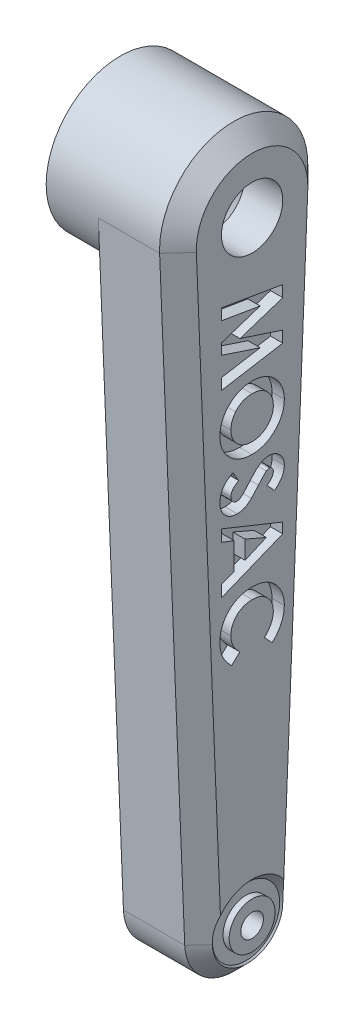
from build123d import *

# Parameters (mm, degrees)
BOSS_EXTRUDE1_DEPTH = 16
BOSS_EXTRUDE2_START = 5.5
SKETCH2_R           = 12.1
BOSS_EXTRUDE2_DEPTH = 5.5
SKETCH3_R           = 1.85
TORNILLO_INF_DEPTH  = 110.847212072
SKETCH4_R           = 1.75
TORNILLO_SUP_DEPTH  = 111.782038255
SKETCH6_R           = 10.8
SKETCH6_R_2         = 1.75
CUT_EXTRUDE4_DEPTH  = 4
SKETCH5_R           = 5
SKETCH5_R_2         = 1.65
CUT_EXTRUDE3_DEPTH  = 8.25
CHAMFER1_SIZE       = 2
CHAMFER2_SIZE       = 3
CHAMFER3_SIZE       = 3
MOSAC_DEPTH         = 2
SKETCH10_R          = 0.8
CUT_EXTRUDE5_DEPTH  = 10
SKETCH11_R          = 5.5
SKETCH11_R_2        = 3.75
CUT_EXTRUDE6_DEPTH  = 1


with BuildPart() as part:
    # Sketch1 → Boss-Extrude1 (new body)
    with BuildSketch(Plane(origin=(0, 0, 0), x_dir=(0, -1, 0), z_dir=(-1, 0, 0))):
        with BuildLine():
            Line((0.4961, -12.089825672), (100.328, -7.993273172))
            ThreePointArc((100.328, -7.993273172), (108, 0), (100.328, 7.993273172))
            Line((100.328, 7.993273172), (0.4961, 12.089825672))
            ThreePointArc((0.4961, 12.089825672), (-12.1, 0), (0.4961, -12.089825672))
        make_face()
    extrude(amount=-BOSS_EXTRUDE1_DEPTH)

    # Sketch2 → Boss-Extrude2 (add)
    with BuildSketch(Plane.ZY.offset(BOSS_EXTRUDE2_START)):
        Circle(SKETCH2_R)
    extrude(amount=-BOSS_EXTRUDE2_DEPTH)

    # Sketch3 → Tornillo_inf (cut, through all)
    with BuildSketch(Plane.ZY):
        with Locations(Location((0, -100, 0), (0, 0, 180))):
            Circle(SKETCH3_R)
    extrude(amount=-TORNILLO_INF_DEPTH, mode=Mode.SUBTRACT)

    # Sketch4 → Tornillo_sup (cut, through all)
    with BuildSketch(Plane.ZY.offset(5.5)):
        with Locations(Location((0, 0, 0), (0, 0, 180))):
            Circle(SKETCH4_R)
    extrude(amount=-TORNILLO_SUP_DEPTH, mode=Mode.SUBTRACT)

    # Sketch6 → Cut-Extrude4 (cut)
    with BuildSketch(Plane.ZY.offset(5.5)):
        with Locations(Location((0, 0, 0), (0, 0, 180))):
            Circle(SKETCH6_R)
        Circle(SKETCH6_R_2, mode=Mode.SUBTRACT)
    extrude(amount=-CUT_EXTRUDE4_DEPTH, mode=Mode.SUBTRACT)

    # Sketch5 → Cut-Extrude3 (cut)
    with BuildSketch(Plane(origin=(16, 0, 0), x_dir=(0, 0, -1), z_dir=(1, 0, 0))):
        with Locations(Location((0, 0, 0), (0, 0, 180))):
            Circle(SKETCH5_R)
        Circle(SKETCH5_R_2, mode=Mode.SUBTRACT)
    extrude(amount=-CUT_EXTRUDE3_DEPTH, mode=Mode.SUBTRACT)

    # Chamfer1
    chamfer1_edges = [part.edges().sort_by_distance(p)[0] for p in [
        (7.75, 0, -5),
    ]]
    chamfer(chamfer1_edges, length=CHAMFER1_SIZE)

    # Chamfer2
    # the kernel refuses this chamfer: 3 mm, written as the material it takes off along each edge
    with BuildSketch(Plane(origin=(0, -100.328, 7.993273172), x_dir=(1, 0, 0), z_dir=(0, 0.9991591464826812, 0.041000000000000016))) as chamfer2_piece_1_section:
        Polygon((CHAMFER2_SIZE, 0), (0, CHAMFER2_SIZE), (0, 0), align=None)
    chamfer2_piece_1 = extrude(amount=113.031497887, mode=Mode.PRIVATE)
    chamfer2_piece_1 = chamfer2_piece_1 - Plane(origin=(0, 0, 0), x_dir=(0, -0.041000000000000016, 0.9991591464826812), z_dir=(-1, 0, 0)) * Cylinder(12.1, 239, mode=Mode.PRIVATE)
    add(chamfer2_piece_1, mode=Mode.SUBTRACT)
    with BuildSketch(Plane(origin=(0, -100, 0), x_dir=(0, -0.041000000000003894, -0.9991591464826811), z_dir=(0, 0.9991591464826811, -0.041000000000003894))) as chamfer2_piece_2:
        Polygon((8, -CHAMFER2_SIZE), (8 - CHAMFER2_SIZE, 0), (8, 0), align=None)
    revolve(axis=Axis((0, -100, 0), (-1, 0, 0)), revolution_arc=175.300428789, mode=Mode.SUBTRACT)
    with BuildSketch(Plane(origin=(0, 12.608454954, -12.627564585), x_dir=(1, 0, 0), z_dir=(0, -0.9991591464826812, 0.041))) as chamfer2_piece_3_section:
        Polygon((CHAMFER2_SIZE, 0), (0, CHAMFER2_SIZE), (0, 0), align=None)
    chamfer2_piece_3 = extrude(amount=113.031497887, mode=Mode.PRIVATE)
    chamfer2_piece_3 = chamfer2_piece_3 - Plane(origin=(0, 0, 0), x_dir=(0, -0.041000000000000016, 0.9991591464826812), z_dir=(-1, 0, 0)) * Cylinder(12.1, 239, mode=Mode.PRIVATE)
    add(chamfer2_piece_3, mode=Mode.SUBTRACT)

    # Chamfer3
    # the kernel refuses this chamfer: 3 mm, written as the material it takes off along each edge
    with BuildSketch(Plane(origin=(16, -100, 0), x_dir=(0, -0.041000000000003894, -0.9991591464826811), z_dir=(0, 0.9991591464826811, -0.041000000000003894))) as chamfer3_piece_1:
        Polygon((8 - CHAMFER3_SIZE, 0), (8, CHAMFER3_SIZE), (8, 0), align=None)
    revolve(axis=Axis((16, -100, 0), (-1, 0, 0)), revolution_arc=175.300428789, mode=Mode.SUBTRACT)
    with BuildSketch(Plane(origin=(16, -100.328, 7.993273172), x_dir=(0, 0.041000000000000016, -0.9991591464826812), z_dir=(0, 0.9991591464826812, 0.041000000000000016)), Plane(origin=(16, -0.4961, -12.089825672), x_dir=(0, 0.040999999999999995, 0.9991591464826812), z_dir=(0, -0.9991591464826812, 0.041))) as chamfer3_piece_2:
        Polygon((CHAMFER3_SIZE, 0), (0, CHAMFER3_SIZE), (0, 0), align=None)
    extrude(amount=99.915914648, mode=Mode.SUBTRACT)
    with BuildSketch(Plane(origin=(16, 0, 0), x_dir=(0, -0.041000000000000016, 0.9991591464826812), z_dir=(0, -0.9991591464826812, -0.041000000000000016))) as chamfer3_piece_3:
        Polygon((12.1 - CHAMFER3_SIZE, 0), (12.1, CHAMFER3_SIZE), (12.1, 0), align=None)
    revolve(axis=Axis((16, 0, 0), (-1, 0, 0)), revolution_arc=184.699571211, mode=Mode.SUBTRACT)

    # Sketch9 → MOSAC (cut)
    # profile 1 of 5: a face of its own
    with BuildSketch(Plane(origin=(16, 0, 0), x_dir=(0, 0, -1), z_dir=(1, 0, 0))):
        Polygon((5, -11.945112179), (5, -13.808092949), (-1.975160256, -16.08974359), (5, -18.387419872), (5, -20.232371795), (-5, -21.923076923), (-5, -20.106169872), (1.316105769, -19.038461538), (-5, -16.959134615), (-5, -15.208333333), (1.316105769, -13.141025641), (-5, -12.075320513), (-5, -10.256410256), align=None)
    # profile 2 of 5: a face of its own
    with BuildSketch(Plane(origin=(16, 0, 0), x_dir=(0, 0, -1), z_dir=(1, 0, 0))):
        with BuildLine():
            add(Edge.make_bspline(
                [(5.256410256, -28.289262821), (5.251911336, -28.463126485), (5.243029449, -28.806372739), (5.168909094, -29.311139709), (5.048346913, -29.797670768), (4.879822721, -30.26586282), (4.662290096, -30.715079941), (4.394853416, -31.144170534), (4.081675968, -31.555904705), (3.72333301, -31.942681214), (3.331751316, -32.297459349), (2.914253996, -32.609391489), (2.475499253, -32.873461463), (2.015876125, -33.089411423), (1.534427408, -33.256631048), (1.031404493, -33.373354539), (0.507735829, -33.44851956), (0.1511695, -33.457151469), (-0.030048077, -33.461538462)],
                knots=[0, 0, 0, 0, 1.014244935, 2.002349224, 2.970143685, 3.935298574, 4.900830986, 5.877310296, 6.881148894, 7.915268703, 8.949887647, 9.960720774, 10.951801935, 11.933244874, 12.919141415, 13.920101769, 14.942934067, 16, 16, 16, 16], degree=3))
            add(Edge.make_bspline(
                [(-0.030048077, -33.461538462), (-0.209223951, -33.456866533), (-0.56229576, -33.447660349), (-1.081135725, -33.376417808), (-1.578780794, -33.25773966), (-2.055516166, -33.093291481), (-2.511445322, -32.88149905), (-2.946092111, -32.622090395), (-3.357799648, -32.312698138), (-3.74555771, -31.963516297), (-4.097423215, -31.579089328), (-4.408348876, -31.171767067), (-4.669928415, -30.742359536), (-4.885969733, -30.293901564), (-5.052991771, -29.824432331), (-5.1709502, -29.335017575), (-5.242608497, -28.825574381), (-5.251763402, -28.47913252), (-5.256410256, -28.303285256)],
                knots=[0, 0, 0, 0, 1.051446269, 2.071908608, 3.067230498, 4.050151293, 5.026863609, 6.012936299, 7.01551645, 8.045060801, 9.071444569, 10.070117656, 11.048150216, 12.017576978, 12.987003741, 13.967083865, 14.968130643, 16, 16, 16, 16], degree=3))
            add(Edge.make_bspline(
                [(-5.256410256, -28.303285256), (-5.252242328, -28.119369727), (-5.244052919, -27.758000851), (-5.166175379, -27.229135883), (-5.048864597, -26.722437546), (-4.873784549, -26.242162397), (-4.654919768, -25.783419246), (-4.385374667, -25.349578612), (-4.065594692, -24.940786294), (-3.703769526, -24.559387192), (-3.307853434, -24.213838682), (-2.889603193, -23.908824343), (-2.452213866, -23.651537981), (-1.995480745, -23.441970184), (-1.522242317, -23.276755351), (-1.029616422, -23.160215058), (-0.518784556, -23.091371926), (-0.171817341, -23.081782478), (0.00400641, -23.076923077)],
                knots=[0, 0, 0, 0, 1.067978421, 2.098431617, 3.099715153, 4.085208694, 5.062210972, 6.048429807, 7.046490867, 8.072918869, 9.098532598, 10.095778865, 11.076610158, 12.041847152, 13.011192615, 13.984257998, 14.978533688, 16, 16, 16, 16], degree=3))
            add(Edge.make_bspline(
                [(0.00400641, -23.076923077), (0.122286467, -23.078468837), (0.357348883, -23.081540783), (0.705786814, -23.117749965), (1.046935988, -23.171418814), (1.381382757, -23.24501223), (1.707871082, -23.343534433), (2.027094539, -23.464863135), (2.340292995, -23.604435493), (2.644443773, -23.767086433), (2.93661283, -23.94804971), (3.215461828, -24.145465629), (3.477596301, -24.359874177), (3.724790244, -24.590541292), (3.955236542, -24.838392492), (4.173231049, -25.100105466), (4.369985289, -25.382221512), (4.554661099, -25.675565799), (4.720144284, -25.979629125), (4.862742883, -26.292668856), (4.985721688, -26.609883799), (5.083345446, -26.935084107), (5.162752873, -27.264490971), (5.215290837, -27.601550477), (5.251799619, -27.943237012), (5.25486973, -28.173647155), (5.256410256, -28.289262821)],
                knots=[0, 0, 0, 0, 1.034751683, 2.056401036, 3.062285641, 4.056148242, 5.050783641, 6.043890034, 7.043081327, 8.049576835, 9.059882113, 10.048974407, 11.037410495, 12.021414423, 13.005418351, 13.997561464, 14.999568372, 16.012961702, 17.030138968, 18.026421002, 19.021605583, 20.005054086, 20.995836695, 21.984410968, 22.988613675, 24, 24, 24, 24], degree=3))
        make_face()
        with BuildLine():
            add(Edge.make_bspline(
                [(3.461538462, -28.261217949), (3.458398836, -28.144208679), (3.452202472, -27.913279204), (3.404994671, -27.574547624), (3.329598153, -27.249353716), (3.220388267, -26.939498413), (3.081388054, -26.643645231), (2.913100018, -26.361245564), (2.709675113, -26.096301627), (2.482277831, -25.844927447), (2.227858341, -25.618618028), (1.95817511, -25.415135205), (1.666739107, -25.250611085), (1.363149445, -25.109143828), (1.039728663, -25.004648379), (0.701725854, -24.925085992), (0.345671179, -24.881751059), (0.103605732, -24.875160882), (-0.020032051, -24.871794872)],
                knots=[0, 0, 0, 0, 1.033668485, 2.040047952, 3.016132939, 3.979056467, 4.937231767, 5.900589077, 6.877725736, 7.88429546, 8.891280164, 9.882584218, 10.863295226, 11.842887319, 12.837417301, 13.860812229, 14.907384602, 16, 16, 16, 16], degree=3))
            add(Edge.make_bspline(
                [(-0.020032051, -24.871794872), (-0.157092598, -24.875877161), (-0.42570856, -24.883877772), (-0.817702108, -24.939608147), (-1.187121949, -25.036403611), (-1.535242855, -25.171078746), (-1.860286116, -25.346251495), (-2.164004755, -25.558622509), (-2.44491745, -25.810076072), (-2.609019021, -26.00356088), (-2.692307692, -26.101762821)],
                knots=[0, 0, 0, 0, 1.078379799, 2.113445728, 3.107478808, 4.077334175, 5.043482131, 6.005506737, 6.987708079, 8, 8, 8, 8], degree=3))
            add(Edge.make_bspline(
                [(-2.692307692, -26.101762821), (-2.753831519, -26.182223616), (-2.875493031, -26.341332412), (-3.031427217, -26.595304692), (-3.165078369, -26.85684613), (-3.273066919, -27.127930386), (-3.358008897, -27.407984942), (-3.417492368, -27.696971395), (-3.45482339, -27.994480276), (-3.459285154, -28.195669724), (-3.461538462, -28.297275641)],
                knots=[0, 0, 0, 0, 1.023928204, 2.024787132, 3.009472467, 3.9914905, 4.972207045, 5.96565515, 6.972602802, 8, 8, 8, 8], degree=3))
            add(Edge.make_bspline(
                [(-3.461538462, -28.297275641), (-3.458372382, -28.412273062), (-3.452143022, -28.638534105), (-3.405513993, -28.970958174), (-3.326613339, -29.289438693), (-3.218329127, -29.595914145), (-3.07770506, -29.889644755), (-2.903455402, -30.169103305), (-2.700635143, -30.436334084), (-2.469317092, -30.687268635), (-2.214776945, -30.916436203), (-1.94228232, -31.116960381), (-1.655283611, -31.287294646), (-1.353574942, -31.425388541), (-1.037256148, -31.535141636), (-0.7058806, -31.60961152), (-0.360639862, -31.657603904), (-0.125697906, -31.663607969), (-0.006009615, -31.666666667)],
                knots=[0, 0, 0, 0, 1.026250569, 2.01918027, 2.989144455, 3.950556051, 4.91558185, 5.889785058, 6.885144561, 7.905911388, 8.931486752, 9.937601838, 10.920932928, 11.905004308, 12.894547393, 13.903711934, 14.932071819, 16, 16, 16, 16], degree=3))
            add(Edge.make_bspline(
                [(-0.006009615, -31.666666667), (0.112990996, -31.66350312), (0.34722555, -31.657276162), (0.691570675, -31.610567395), (1.02151267, -31.532158602), (1.337590364, -31.423580927), (1.640113631, -31.284932986), (1.928018619, -31.113480742), (2.201026997, -30.909825799), (2.457278314, -30.678655262), (2.692756861, -30.427040342), (2.897109434, -30.156906583), (3.074685323, -29.875812633), (3.213791104, -29.577308824), (3.324616384, -29.267502294), (3.406229711, -28.944502588), (3.451870846, -28.607086324), (3.458287198, -28.377535063), (3.461538462, -28.261217949)],
                knots=[0, 0, 0, 0, 1.055025985, 2.07665775, 3.074803781, 4.057872707, 5.035505728, 6.020516407, 7.023567878, 8.050795229, 9.077271434, 10.074415901, 11.050397877, 12.019801805, 12.988065821, 13.964604439, 14.968634123, 16, 16, 16, 16], degree=3))
        make_face(mode=Mode.SUBTRACT)
    # profile 3 of 5: a face of its own
    with BuildSketch(Plane(origin=(16, 0, 0), x_dir=(0, 0, -1), z_dir=(1, 0, 0))):
        with BuildLine():
            Line((3.663862179, -40.384615385), (2.435897436, -39.042467949))
            add(Edge.make_bspline(
                [(2.435897436, -39.042467949), (2.517010143, -38.98498717), (2.672735229, -38.874632092), (2.881027157, -38.695578218), (3.05988134, -38.517594063), (3.204184129, -38.337040561), (3.320352421, -38.157026275), (3.400478375, -37.973726708), (3.452007856, -37.789250592), (3.458393276, -37.665246027), (3.461538462, -37.604166667)],
                knots=[0, 0, 0, 0, 1.299459705, 2.494781419, 3.587730629, 4.594196874, 5.512431013, 6.380462003, 7.202284646, 8, 8, 8, 8], degree=3))
            add(Edge.make_bspline(
                [(3.461538462, -37.604166667), (3.459540588, -37.547198374), (3.455683218, -37.437207567), (3.417341249, -37.280407512), (3.351168643, -37.14119819), (3.264642393, -37.019715464), (3.160398321, -36.923483221), (3.051073094, -36.846649238), (2.930402767, -36.803385249), (2.847521519, -36.797690857), (2.806490385, -36.794871795)],
                knots=[0, 0, 0, 0, 1.185010067, 2.2879431, 3.333075148, 4.379039566, 5.372662701, 6.27520591, 7.14612461, 8, 8, 8, 8], degree=3))
            add(Edge.make_bspline(
                [(2.806490385, -36.794871795), (2.764867563, -36.796638358), (2.681044985, -36.800195971), (2.558192557, -36.834557668), (2.438151434, -36.886350556), (2.36507669, -36.935840776), (2.327724359, -36.961137821)],
                knots=[0, 0, 0, 0, 0.967525499, 1.948461899, 2.951351359, 4, 4, 4, 4], degree=3))
            add(Edge.make_bspline(
                [(2.327724359, -36.961137821), (2.298694276, -36.984138934), (2.23187086, -37.037084459), (2.125938811, -37.137947578), (1.997038511, -37.264790237), (1.845876023, -37.420217477), (1.674420772, -37.604038611), (1.481669865, -37.817880506), (1.266413463, -38.058721923), (1.11631382, -38.229711054), (1.037660256, -38.319310897)],
                knots=[0, 0, 0, 0, 0.473868417, 1.090782513, 1.870421581, 2.78911798, 3.865477667, 5.087766164, 6.473963263, 8, 8, 8, 8], degree=3))
            add(Edge.make_bspline(
                [(1.037660256, -38.319310897), (0.964859504, -38.403429899), (0.8266988, -38.563070287), (0.630601864, -38.790206858), (0.454178233, -38.989822074), (0.300075646, -39.164823875), (0.166677216, -39.312559402), (0.0533453, -39.433649738), (-0.037713739, -39.529573795), (-0.092713454, -39.584101005), (-0.116185897, -39.607371795)],
                knots=[0, 0, 0, 0, 1.543621617, 2.929473131, 4.163658386, 5.240097082, 6.164993805, 6.925417477, 7.541396219, 8, 8, 8, 8], degree=3))
            add(Edge.make_bspline(
                [(-0.116185897, -39.607371795), (-0.211694389, -39.695706656), (-0.395295251, -39.865517281), (-0.68066083, -40.085644065), (-0.957325853, -40.269571138), (-1.233791189, -40.41037125), (-1.513377589, -40.513434594), (-1.800899278, -40.588920535), (-2.101291249, -40.633495312), (-2.306209739, -40.638496223), (-2.409855769, -40.641025641)],
                knots=[0, 0, 0, 0, 1.20648512, 2.3192881, 3.339983362, 4.284774958, 5.190427137, 6.099526693, 7.038756749, 8, 8, 8, 8], degree=3))
            add(Edge.make_bspline(
                [(-2.409855769, -40.641025641), (-2.51085047, -40.639234406), (-2.709005831, -40.635719936), (-2.998990133, -40.592721028), (-3.276466256, -40.53131948), (-3.538654293, -40.436706878), (-3.788661957, -40.320420729), (-4.0265712, -40.178695249), (-4.246835778, -40.005424364), (-4.455368289, -39.812960905), (-4.642637668, -39.59678644), (-4.807407943, -39.364189808), (-4.947622357, -39.115605341), (-5.058671223, -38.850105608), (-5.147844324, -38.569315809), (-5.211209834, -38.272880975), (-5.250366217, -37.960454429), (-5.254366549, -37.747179841), (-5.256410256, -37.638221154)],
                knots=[0, 0, 0, 0, 1.043082113, 2.046565928, 3.024368146, 3.976196322, 4.921091788, 5.871642728, 6.831173094, 7.81279273, 8.801063391, 9.781590382, 10.755046466, 11.74476232, 12.751114423, 13.796272686, 14.874149815, 16, 16, 16, 16], degree=3))
            add(Edge.make_bspline(
                [(-5.256410256, -37.638221154), (-5.254893461, -37.552694499), (-5.251889336, -37.383302673), (-5.227347807, -37.133648281), (-5.187778481, -36.892565139), (-5.130930801, -36.660388041), (-5.059555794, -36.436429097), (-4.970733878, -36.220896476), (-4.866189439, -36.014018403), (-4.745863013, -35.814462782), (-4.606227143, -35.623605091), (-4.450185329, -35.438879411), (-4.274355046, -35.262593069), (-4.08216547, -35.091130432), (-3.868691255, -34.930554128), (-3.640090391, -34.7726308), (-3.390973966, -34.62500474), (-3.216248894, -34.53377673), (-3.127003205, -34.487179487)],
                knots=[0, 0, 0, 0, 1.016957334, 2.014158747, 2.980235577, 3.920141478, 4.854360818, 5.773095257, 6.689355356, 7.608638744, 8.541033765, 9.498850575, 10.481527934, 11.499755671, 12.559141621, 13.65604909, 14.802761907, 16, 16, 16, 16], degree=3))
            Line((-3.127003205, -34.487179487), (-2.179487179, -36.065705128))
            add(Edge.make_bspline(
                [(-2.179487179, -36.065705128), (-2.28079579, -36.123987444), (-2.475013056, -36.235719625), (-2.735968567, -36.425060252), (-2.959433767, -36.619030057), (-3.141458893, -36.82211345), (-3.284477855, -37.031841013), (-3.386689127, -37.249225777), (-3.449957789, -37.474420474), (-3.457684354, -37.627812871), (-3.461538462, -37.704326923)],
                knots=[0, 0, 0, 0, 1.283663364, 2.460892379, 3.537111102, 4.529833553, 5.449777664, 6.316464042, 7.160231139, 8, 8, 8, 8], degree=3))
            add(Edge.make_bspline(
                [(-3.461538462, -37.704326923), (-3.458420897, -37.782167001), (-3.452372368, -37.933188089), (-3.395401354, -38.149106235), (-3.307958362, -38.347935761), (-3.180785977, -38.51887866), (-3.035772466, -38.664042043), (-2.872220062, -38.76810927), (-2.697384567, -38.835614044), (-2.57538249, -38.842626821), (-2.514022436, -38.846153846)],
                knots=[0, 0, 0, 0, 1.13537643, 2.202795631, 3.242191317, 4.290390765, 5.297919085, 6.223733717, 7.106639842, 8, 8, 8, 8], degree=3))
            add(Edge.make_bspline(
                [(-2.514022436, -38.846153846), (-2.456965542, -38.84285245), (-2.341059924, -38.836145979), (-2.16862686, -38.787017025), (-1.997029918, -38.709568996), (-1.854791829, -38.620688285), (-1.736230467, -38.528025357), (-1.635047073, -38.437197937), (-1.520918207, -38.329551734), (-1.39695604, -38.202343864), (-1.260777172, -38.0580485), (-1.112705381, -37.896193248), (-0.95394767, -37.715035077), (-0.845807904, -37.58698698), (-0.789262821, -37.520032051)],
                knots=[0, 0, 0, 0, 0.916057066, 1.860882232, 2.859899639, 3.934694552, 4.546382938, 5.276161949, 6.118633209, 7.067046139, 8.129668089, 9.306861125, 10.591787583, 12, 12, 12, 12], degree=3))
            add(Edge.make_bspline(
                [(-0.789262821, -37.520032051), (-0.681565252, -37.39275294), (-0.47486102, -37.148465801), (-0.169627035, -36.803193744), (0.115858791, -36.492295265), (0.383861947, -36.217817872), (0.632729012, -35.979029609), (0.860089228, -35.773038272), (1.070555128, -35.604329309), (1.32025851, -35.426973985), (1.622940449, -35.255754477), (1.98904219, -35.110528418), (2.354317076, -35.015780013), (2.599617494, -35.005204962), (2.720352564, -35)],
                knots=[0, 0, 0, 0, 1.34561873, 2.582649632, 3.719171478, 4.751946187, 5.678152813, 6.502542634, 7.227205346, 7.853698961, 8.973370308, 10.023159194, 11.027013428, 12, 12, 12, 12], degree=3))
            add(Edge.make_bspline(
                [(2.720352564, -35), (2.805965554, -35.002172625), (2.974632339, -35.006452929), (3.222660686, -35.044522184), (3.461876686, -35.101679608), (3.692207516, -35.183829792), (3.911104201, -35.293973725), (4.12193525, -35.424228316), (4.324333289, -35.577282192), (4.511698937, -35.75492979), (4.685752072, -35.94764493), (4.838531511, -36.154052384), (4.967022325, -36.371996926), (5.075175558, -36.599936878), (5.156570242, -36.840801452), (5.214781623, -37.09240165), (5.249313103, -37.354809966), (5.254015065, -37.533283728), (5.256410256, -37.624198718)],
                knots=[0, 0, 0, 0, 1.010961173, 1.991702108, 2.958025473, 3.913824419, 4.873522744, 5.847800578, 6.838738273, 7.865764422, 8.893759806, 9.903642949, 10.894078012, 11.878777586, 12.879248405, 13.891624672, 14.925988217, 16, 16, 16, 16], degree=3))
            add(Edge.make_bspline(
                [(5.256410256, -37.624198718), (5.252088424, -37.742015386), (5.243478874, -37.97671872), (5.176509393, -38.323838732), (5.070073056, -38.663051301), (4.94472276, -38.937263043), (4.81936267, -39.153520867), (4.706470707, -39.319818383), (4.57633527, -39.489365), (4.42843769, -39.663034487), (4.263765708, -39.839944274), (4.078970683, -40.018605786), (3.88007621, -40.203371245), (3.737196101, -40.323142299), (3.663862179, -40.384615385)],
                knots=[0, 0, 0, 0, 1.282867522, 2.555608537, 3.83715526, 5.14906667, 5.830341525, 6.558732832, 7.337173124, 8.157810814, 9.043130442, 9.96912168, 10.957641678, 12, 12, 12, 12], degree=3))
        make_face()
    # profile 4 of 5: a face of its own
    with BuildSketch(Plane(origin=(16, 0, 0), x_dir=(0, 0, -1), z_dir=(1, 0, 0))):
        Polygon((5, -45.514823718), (5, -47.179487179), (-5, -51.217948718), (-5, -49.30088141), (-2.948717949, -48.523637821), (-2.948717949, -44.166666667), (-5, -43.389423077), (-5, -41.474358974), align=None)
        Polygon((2.317708333, -46.346153846), (-1.153846154, -44.84775641), (-1.153846154, -47.844551282), align=None, mode=Mode.SUBTRACT)
    # profile 5 of 5: a face of its own
    with BuildSketch(Plane(origin=(16, 0, 0), x_dir=(0, 0, -1), z_dir=(1, 0, 0))):
        with BuildLine():
            Line((3.265224359, -61.666666667), (2.007211538, -60.350560897))
            add(Edge.make_bspline(
                [(2.007211538, -60.350560897), (2.12279864, -60.239037628), (2.348943998, -60.020843129), (2.645323421, -59.667756001), (2.89616306, -59.303837527), (3.104802421, -58.931534862), (3.263962887, -58.545102406), (3.37839103, -58.149626236), (3.449643603, -57.742956488), (3.457551475, -57.468235989), (3.461538462, -57.329727564)],
                knots=[0, 0, 0, 0, 1.115306757, 2.182089883, 3.196083701, 4.1824169, 5.141279108, 6.092660653, 7.038358735, 8, 8, 8, 8], degree=3))
            add(Edge.make_bspline(
                [(3.461538462, -57.329727564), (3.458336528, -57.214067195), (3.452017866, -56.985824199), (3.405695837, -56.650703671), (3.32692321, -56.330143566), (3.21835994, -56.023046557), (3.077884829, -55.730316289), (2.905606604, -55.451339018), (2.70308118, -55.18680255), (2.471356434, -54.940201259), (2.218179736, -54.714619064), (1.948040802, -54.515302831), (1.661558508, -54.348343514), (1.361634133, -54.211322718), (1.046879481, -54.104588815), (0.717506456, -54.028367399), (0.3731228, -53.984282968), (0.139013357, -53.977703071), (0.020032051, -53.974358974)],
                knots=[0, 0, 0, 0, 1.035432265, 2.043311493, 3.022114605, 3.98653278, 4.95457646, 5.923598177, 6.917315552, 7.932509744, 8.948865224, 9.949768934, 10.933144597, 11.912367597, 12.897413939, 13.903909035, 14.934704909, 16, 16, 16, 16], degree=3))
            add(Edge.make_bspline(
                [(0.020032051, -53.974358974), (-0.063477777, -53.975321478), (-0.228077365, -53.977218591), (-0.471558524, -53.998029974), (-0.707821102, -54.03144786), (-0.936375427, -54.080140661), (-1.158105841, -54.139942322), (-1.372952792, -54.21426343), (-1.580787188, -54.302526862), (-1.781217086, -54.402232052), (-1.971929961, -54.514759003), (-2.152970066, -54.638931532), (-2.322032332, -54.775966438), (-2.484899944, -54.919461448), (-2.631847431, -55.079137147), (-2.771394504, -55.247575711), (-2.898795852, -55.428363732), (-3.017507917, -55.617456021), (-3.120620606, -55.816565536), (-3.214024527, -56.020268558), (-3.289881475, -56.231659429), (-3.351029341, -56.448162794), (-3.4030264, -56.66900536), (-3.435042602, -56.896347061), (-3.459288092, -57.12821716), (-3.460785109, -57.284922426), (-3.461538462, -57.363782051)],
                knots=[0, 0, 0, 0, 1.103757074, 2.175527871, 3.227929046, 4.25632503, 5.262816555, 6.262237806, 7.259082723, 8.246028863, 9.219500025, 10.184246818, 11.145149257, 12.095245763, 13.050780899, 14.010384931, 14.985255937, 15.972438916, 16.959582425, 17.947317807, 18.933039374, 19.924907969, 20.920697008, 21.929431285, 22.958016685, 24, 24, 24, 24], degree=3))
            add(Edge.make_bspline(
                [(-3.461538462, -57.363782051), (-3.45766366, -57.497539568), (-3.450050683, -57.760338305), (-3.390689057, -58.146066823), (-3.292444574, -58.51410007), (-3.177589242, -58.808627377), (-3.063871739, -59.038970349), (-2.957219789, -59.21274694), (-2.839971614, -59.393639276), (-2.704900233, -59.577646252), (-2.554644448, -59.76677964), (-2.385706839, -59.957578101), (-2.203709771, -60.154962062), (-2.073812351, -60.284264926), (-2.007211538, -60.350560897)],
                knots=[0, 0, 0, 0, 1.404522537, 2.759521553, 4.088271485, 5.398566954, 6.072955186, 6.783849712, 7.538645654, 8.336900766, 9.180343671, 10.075042757, 11.013038782, 12, 12, 12, 12], degree=3))
            Line((-2.007211538, -60.350560897), (-3.347355769, -61.626602564))
            add(Edge.make_bspline(
                [(-3.347355769, -61.626602564), (-3.433957207, -61.536903704), (-3.602984692, -61.361830713), (-3.842987892, -61.097737947), (-4.058657659, -60.833977622), (-4.257820877, -60.576921326), (-4.434678825, -60.322359301), (-4.589396308, -60.070314759), (-4.725927774, -59.823654133), (-4.841826881, -59.577209083), (-4.940865337, -59.329023309), (-5.024389476, -59.073773854), (-5.097300324, -58.811338757), (-5.154677403, -58.539544521), (-5.201386315, -58.259603866), (-5.232250536, -57.970617241), (-5.253652932, -57.673934888), (-5.255483647, -57.473330163), (-5.256410256, -57.371794872)],
                knots=[0, 0, 0, 0, 1.244537013, 2.429070097, 3.56066612, 4.644477994, 5.67429546, 6.652817684, 7.595405349, 8.486886006, 9.369351459, 10.26090686, 11.166404474, 12.086719576, 13.0323422, 13.998023148, 14.9867073, 16, 16, 16, 16], degree=3))
            add(Edge.make_bspline(
                [(-5.256410256, -57.371794872), (-5.251647583, -57.185294307), (-5.242328355, -56.820364543), (-5.173516885, -56.285517929), (-5.057394025, -55.777006477), (-4.895395374, -55.293916468), (-4.68504099, -54.83772636), (-4.429800113, -54.407005532), (-4.127250233, -54.002471269), (-3.781899066, -53.627604546), (-3.400407452, -53.288626002), (-2.990947081, -52.98866952), (-2.550577513, -52.74163681), (-2.088731747, -52.532042252), (-1.598189353, -52.374982969), (-1.083382944, -52.260657655), (-0.542103312, -52.191091297), (-0.172483077, -52.183406484), (0.016025641, -52.179487179)],
                knots=[0, 0, 0, 0, 1.07798487, 2.109316747, 3.111276023, 4.08905949, 5.049398091, 6.009992678, 6.978127636, 7.964347882, 8.951383687, 9.924270623, 10.892397886, 11.86520058, 12.851549246, 13.863953586, 14.910602472, 16, 16, 16, 16], degree=3))
            add(Edge.make_bspline(
                [(0.016025641, -52.179487179), (0.138961165, -52.181215477), (0.382589327, -52.18464054), (0.741798588, -52.217781291), (1.090945438, -52.269907276), (1.428955815, -52.341585839), (1.757713262, -52.434054402), (2.075052801, -52.547698937), (2.382289406, -52.683021528), (2.677458593, -52.839425014), (2.962196328, -53.012584785), (3.23153719, -53.206838145), (3.488378104, -53.416233393), (3.729376153, -53.645932821), (3.955479457, -53.892808572), (4.169460611, -54.156180565), (4.367310711, -54.439231561), (4.550001649, -54.737891389), (4.716882358, -55.047470906), (4.860368552, -55.365805214), (4.983728645, -55.689966716), (5.084102937, -56.019816455), (5.159609459, -56.356883024), (5.216644308, -56.698446799), (5.248553439, -57.047337734), (5.253774633, -57.281590512), (5.256410256, -57.399839744)],
                knots=[0, 0, 0, 0, 1.072042128, 2.124525481, 3.143421661, 4.149789678, 5.136208088, 6.119957821, 7.087418232, 8.061778743, 9.031690376, 9.991741907, 10.955971237, 11.919971873, 12.892764515, 13.874218568, 14.877632952, 15.902487591, 16.926514439, 17.94307752, 18.945815567, 19.949956505, 20.947454389, 21.956649761, 22.968530506, 24, 24, 24, 24], degree=3))
            add(Edge.make_bspline(
                [(5.256410256, -57.399839744), (5.254899119, -57.500718264), (5.251892556, -57.70142645), (5.226829583, -58.000314618), (5.187468438, -58.296812419), (5.128080852, -58.589858299), (5.057580283, -58.881548422), (4.965269512, -59.168049653), (4.862371762, -59.453881704), (4.739378512, -59.734561723), (4.60512027, -60.010481499), (4.452799419, -60.275177176), (4.291789614, -60.53309297), (4.112561589, -60.778513623), (3.921616277, -61.016036391), (3.718062813, -61.244419247), (3.498507361, -61.461657998), (3.343378474, -61.597984976), (3.265224359, -61.666666667)],
                knots=[0, 0, 0, 0, 0.996412454, 1.982464992, 2.961075852, 3.949442424, 4.934965278, 5.923860011, 6.921385422, 7.934793307, 8.949617135, 9.951082467, 10.950285876, 11.951772932, 12.951063433, 13.960125323, 14.972308753, 16, 16, 16, 16], degree=3))
        make_face()
    extrude(amount=-MOSAC_DEPTH, mode=Mode.SUBTRACT)

    # Sketch10 → Cut-Extrude5 (cut)
    with BuildSketch(Plane.ZY.offset(1.5)):
        with Locations((0, 7.8)):
            Circle(SKETCH10_R)
        with Locations((7.8, 0)):
            Circle(SKETCH10_R)
        with Locations((0, -7.8)):
            Circle(SKETCH10_R)
        with Locations((-7.8, 0)):
            Circle(SKETCH10_R)
    extrude(amount=-CUT_EXTRUDE5_DEPTH, mode=Mode.SUBTRACT)

    # Sketch11 → Cut-Extrude6 (cut)
    with BuildSketch(Plane(origin=(16, 0, 0), x_dir=(0, 0, -1), z_dir=(1, 0, 0))):
        with Locations((0, -100)):
            Circle(SKETCH11_R)
        with Locations((0, -100)):
            Circle(SKETCH11_R_2, mode=Mode.SUBTRACT)
    cut_extrude6 = extrude(amount=-CUT_EXTRUDE6_DEPTH, mode=Mode.SUBTRACT)

    # Mirror1: Cut-Extrude6 across plane
    add(cut_extrude6.mirror(Plane.ZY.offset(-8)), mode=Mode.SUBTRACT)

    # Chamfer4: read off the stored shape, not the designer's step
    # Chamfer4 outline → Chamfer4 (revolve, cut)
    with BuildSketch(Plane(origin=(0, -100, 0), x_dir=(0, 1, 0), z_dir=(0, 0, -1))):
        Polygon((5.5, 16), (5.5, 15), (6.5, 16), align=None)
        Polygon((6.5, 0), (5.5, 1), (5.5, 0), align=None)
    revolve(axis=Axis((0, -100, 0), (1, 0, 0)), mode=Mode.SUBTRACT)


solid = part.part
